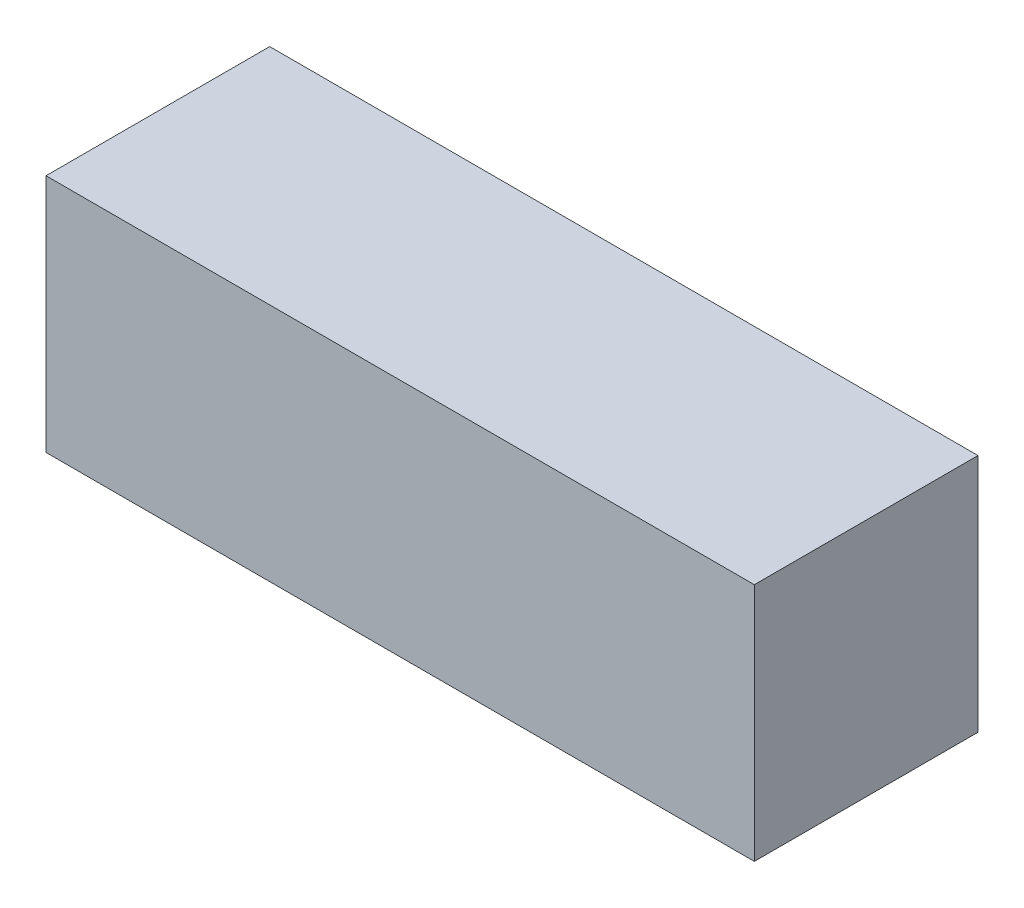
from build123d import *

# Parameters (mm, degrees)
SKETCH1_W           = 133
SKETCH1_H           = 45
BOSS_EXTRUDE1_DEPTH = 42
SKETCH2_W           = 10
SKETCH2_H           = 17
CUT_EXTRUDE1_DEPTH  = 122


with BuildPart() as part:
    # Sketch1 → Boss-Extrude1 (new body)
    with BuildSketch(Plane.XY):
        with Locations((66.5, 22.5)):
            Rectangle(SKETCH1_W, SKETCH1_H)
    extrude(amount=BOSS_EXTRUDE1_DEPTH)

    # Sketch2 → Cut-Extrude1 (cut)
    with BuildSketch(Plane.ZY):
        with Locations((7, 22.5)):
            Rectangle(SKETCH2_W, SKETCH2_H)
    extrude(amount=-CUT_EXTRUDE1_DEPTH, mode=Mode.SUBTRACT)


solid = part.part
